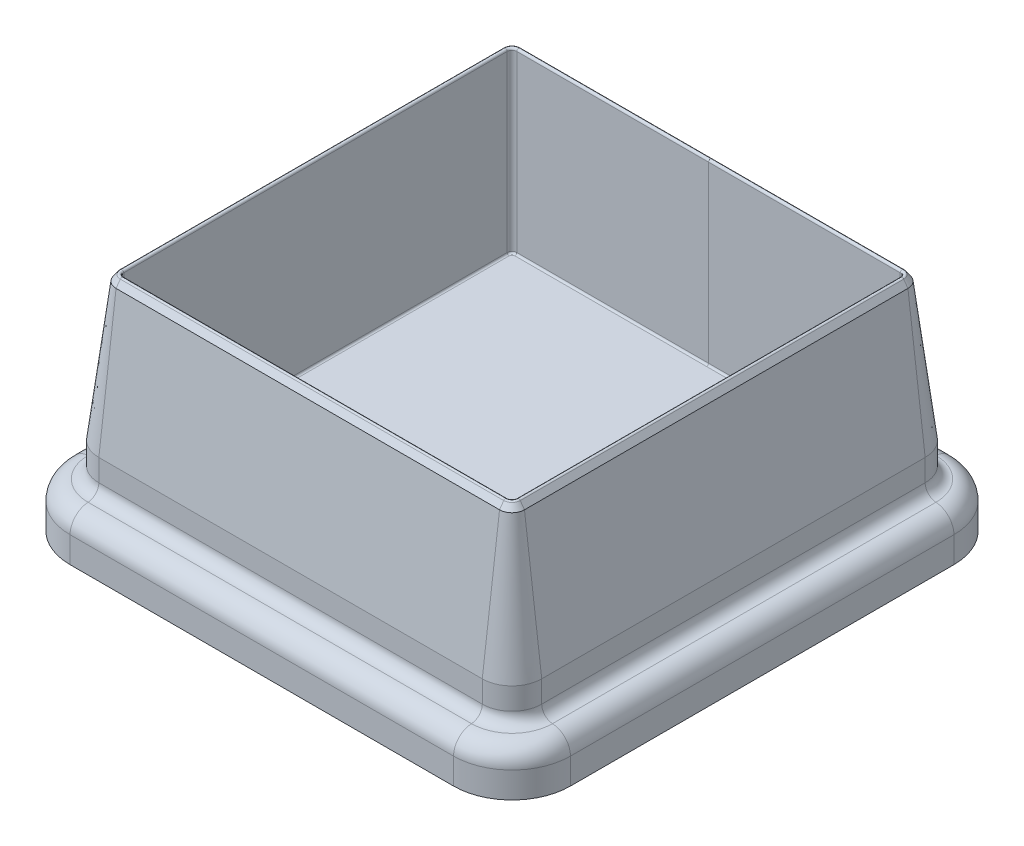
from build123d import *

# Parameters (mm, degrees)
BOSS_EXTRUDE1_DEPTH = 5.969
CUT_EXTRUDE1_DEPTH  = 0.635
BOSS_EXTRUDE2_DEPTH = 5.969
FILLET4_R           = 1.524
FILLET5_R           = 2.54
FILLET3_R           = 0.254


with BuildPart() as part:
    # Sweep1: sweep along a path in Sketch1
    with BuildLine(Plane(origin=(0, 0, 0), x_dir=(1, 0, 0), z_dir=(0, 1, 0))) as sweep1_path:
        Line((-25.4, 28.575), (25.4, 28.575))
        ThreePointArc((25.4, 28.575), (27.64506403, 27.64506403), (28.575, 25.4))
        Line((28.575, 25.4), (28.575, -25.4))
        ThreePointArc((28.575, -25.4), (27.64506403, -27.64506403), (25.4, -28.575))
        Line((25.4, -28.575), (-25.4, -28.575))
        ThreePointArc((-25.4, -28.575), (-27.64506403, -27.64506403), (-28.575, -25.4))
        Line((-28.575, -25.4), (-28.575, 25.4))
        ThreePointArc((-28.575, 25.4), (-27.64506403, 27.64506403), (-25.4, 28.575))
    # Sketch2 → Sweep1 (sweep)
    with BuildSketch(Plane(origin=(0, 0, 0), x_dir=(0, 0, -1), z_dir=(1, 0, 0))):
        Polygon((27.051, 22.68081304), (29.337, 4.432166315), (29.337, 0), (26.035, 0), (26.035, 24.13), align=None)
    sweep(path=sweep1_path.line)

    # Sketch3 → Boss-Extrude1 (add)
    with BuildSketch(Plane.XZ):
        with BuildLine():
            Line((-25.4, -29.337), (0, -29.337))
            Line((0, -29.337), (25.4, -29.337))
            ThreePointArc((25.4, -29.337), (28.183879398, -28.183879398), (29.337, -25.4))
            Line((29.337, -25.4), (29.337, 25.4))
            ThreePointArc((29.337, 25.4), (28.183879398, 28.183879398), (25.4, 29.337))
            Line((25.4, 29.337), (-25.4, 29.337))
            ThreePointArc((-25.4, 29.337), (-28.183879398, 28.183879398), (-29.337, 25.4))
            Line((-29.337, 25.4), (-29.337, -25.4))
            ThreePointArc((-29.337, -25.4), (-28.183879398, -28.183879398), (-25.4, -29.337))
        make_face()
    extrude(amount=BOSS_EXTRUDE1_DEPTH)

    # Sketch4 → Cut-Extrude1 (cut)
    with BuildSketch(Plane.XZ.offset(5.969)):
        with BuildLine():
            Line((-25.4, -27.432), (25.4, -27.432))
            ThreePointArc((25.4, -27.432), (26.836840979, -26.836840979), (27.432, -25.4))
            Line((27.432, -25.4), (27.432, 25.4))
            ThreePointArc((27.432, 25.4), (26.836840979, 26.836840979), (25.4, 27.432))
            Line((25.4, 27.432), (-25.4, 27.432))
            ThreePointArc((-25.4, 27.432), (-26.836840979, 26.836840979), (-27.432, 25.4))
            Line((-27.432, 25.4), (-27.432, -25.4))
            ThreePointArc((-27.432, -25.4), (-26.836840979, -26.836840979), (-25.4, -27.432))
        make_face()
    extrude(amount=-CUT_EXTRUDE1_DEPTH, mode=Mode.SUBTRACT)

    # Sketch5 → Boss-Extrude2 (add)
    with BuildSketch(Plane.XZ.offset(5.969)):
        with BuildLine():
            Line((-33.147, 25.4), (-33.147, -25.4))
            ThreePointArc((-33.147, -25.4), (-30.877956234, -30.877956234), (-25.4, -33.147))
            Line((-25.4, -33.147), (25.4, -33.147))
            ThreePointArc((25.4, -33.147), (30.877956234, -30.877956234), (33.147, -25.4))
            Line((33.147, -25.4), (33.147, 25.4))
            ThreePointArc((33.147, 25.4), (30.877956234, 30.877956234), (25.4, 33.147))
            Line((25.4, 33.147), (-25.4, 33.147))
            ThreePointArc((-25.4, 33.147), (-30.877956234, 30.877956234), (-33.147, 25.4))
        make_face()
        with BuildLine():
            Line((-27.432, 25.4), (-27.432, -25.4))
            ThreePointArc((-27.432, -25.4), (-26.836840979, -26.836840979), (-25.4, -27.432))
            Line((-25.4, -27.432), (25.4, -27.432))
            ThreePointArc((25.4, -27.432), (26.836840979, -26.836840979), (27.432, -25.4))
            Line((27.432, -25.4), (27.432, 25.4))
            ThreePointArc((27.432, 25.4), (26.836840979, 26.836840979), (25.4, 27.432))
            Line((25.4, 27.432), (-25.4, 27.432))
            ThreePointArc((-25.4, 27.432), (-26.836840979, 26.836840979), (-27.432, 25.4))
        make_face(mode=Mode.SUBTRACT)
    extrude(amount=-BOSS_EXTRUDE2_DEPTH)

    # Fillet4
    fillet4_edges = [part.edges().sort_by_distance(p)[0] for p in [
        (0, 0, -29.337),
        (0, 0, -29.337),
        (-28.183879398, 0, -28.183879398),
        (-29.337, 0, 0),
        (-28.183879398, 0, 28.183879398),
        (0, 0, 29.337),
        (28.183879398, 0, 28.183879398),
        (29.337, 0, 0),
        (28.183879398, 0, -28.183879398),
    ]]
    fillet(fillet4_edges, radius=FILLET4_R)

    # Fillet5
    # the kernel refuses this fillet: 2.54 mm, written as the material it takes off along each edge
    with BuildSketch(Plane(origin=(-25.4, 0, -25.4), x_dir=(-1, 0, 0), z_dir=(0, 0, 1))) as fillet5_piece_1:
        with BuildLine():
            CenterArc((5.207, 2.532054733), FILLET5_R, 273.583321698, 86.416678302)
            Line((7.747, 2.532054733), (8.001, 2.532054733))
            Line((8.001, 2.532054733), (8.001, 0))
            Line((8.001, 0), (7.747, -0.254))
            ThreePointArc((7.747, -0.254), (5.461, -0.254), (5.381625, -0.256482896))
            Line((5.381625, -0.256482896), (5.36575, -0.002979475))
        make_face()
    revolve(axis=Axis((-25.4, 0, -25.4), (0, -1, 0)), revolution_arc=90, mode=Mode.SUBTRACT)
    with BuildSketch(Plane(origin=(-33.147, 0, 25.4), x_dir=(0.9999992172213047, 0.001251222113716365, 0), z_dir=(0, 0, -1)), Plane(origin=(25.4, 0, 33.147), x_dir=(0, 0.0012512221137164234, -0.9999992172213047), z_dir=(-1, 0, 0)), Plane(origin=(33.147, 0, -25.4), x_dir=(-0.9999992172213047, 0.0012512221137164405, 0), z_dir=(0, 0, 1)), Plane(origin=(-25.4, 0, -33.147), x_dir=(0, 0.001251222113716569, 0.9999992172213047), z_dir=(1, 0, 0))) as fillet5_piece_2:
        with BuildLine():
            CenterArc((2.536829849, 2.535230855), FILLET5_R, 180.071689765, 86.416678302)
            Line((-0.003168163, 2.532052751), (-0.257167964, 2.531734941))
            Line((-0.257167964, 2.531734941), (-0.253999801, -0.00031781))
            Line((-0.253999801, -0.00031781), (0.00031781, -0.253999801))
            ThreePointArc((0.00031781, -0.253999801), (2.286316021, -0.251139507), (2.365694066, -0.253523086))
            Line((2.365694066, -0.253523086), (2.381251864, 0))
        make_face()
    extrude(amount=50.8, mode=Mode.SUBTRACT)
    with BuildSketch(Plane(origin=(-25.4, 0, 25.4), x_dir=(0, 0, 1), z_dir=(1, 0, 0))) as fillet5_piece_3:
        with BuildLine():
            CenterArc((5.207, 2.532054733), FILLET5_R, 273.583321698, 86.416678302)
            Line((7.747, 2.532054733), (8.001, 2.532054733))
            Line((8.001, 2.532054733), (8.001, 0))
            Line((8.001, 0), (7.747, -0.254))
            ThreePointArc((7.747, -0.254), (5.461, -0.254), (5.381625, -0.256482896))
            Line((5.381625, -0.256482896), (5.36575, -0.002979475))
        make_face()
    revolve(axis=Axis((-25.4, 0, 25.4), (0, -1, 0)), revolution_arc=90, mode=Mode.SUBTRACT)
    with BuildSketch(Plane(origin=(25.4, 0, 25.4), x_dir=(1, 0, 0), z_dir=(0, 0, -1))) as fillet5_piece_4:
        with BuildLine():
            CenterArc((5.207, 2.532054733), FILLET5_R, 273.583321698, 86.416678302)
            Line((7.747, 2.532054733), (8.001, 2.532054733))
            Line((8.001, 2.532054733), (8.001, 0))
            Line((8.001, 0), (7.747, -0.254))
            ThreePointArc((7.747, -0.254), (5.461, -0.254), (5.381625, -0.256482896))
            Line((5.381625, -0.256482896), (5.36575, -0.002979475))
        make_face()
    revolve(axis=Axis((25.4, 0, 25.4), (0, -1, 0)), revolution_arc=90, mode=Mode.SUBTRACT)
    with BuildSketch(Plane(origin=(25.4, 0, -25.4), x_dir=(0, 0, -1), z_dir=(-1, 0, 0))) as fillet5_piece_5:
        with BuildLine():
            CenterArc((5.207, 2.532054733), FILLET5_R, 273.583321698, 86.416678302)
            Line((7.747, 2.532054733), (8.001, 2.532054733))
            Line((8.001, 2.532054733), (8.001, 0))
            Line((8.001, 0), (7.747, -0.254))
            ThreePointArc((7.747, -0.254), (5.461, -0.254), (5.381625, -0.256482896))
            Line((5.381625, -0.256482896), (5.36575, -0.002979475))
        make_face()
    revolve(axis=Axis((25.4, 0, -25.4), (0, -1, 0)), revolution_arc=90, mode=Mode.SUBTRACT)

    # Fillet3
    fillet3_edges = [part.edges().sort_by_distance(p)[0] for p in [
        (25.849012806, 24.13, 25.849012806),
        (0, 0, 26.035),
        (0, 24.13, 26.035),
        (-25.849012806, 0, 25.849012806),
        (-25.849012806, 24.13, 25.849012806),
        (0, 0, -26.035),
        (-26.035, 0, 0),
        (-26.035, 24.13, 0),
        (-25.849012806, 0, -25.849012806),
        (-25.849012806, 24.13, -25.849012806),
        (0, 0, -26.035),
        (0, 24.13, -26.035),
        (0, 24.13, -26.035),
        (25.849012806, 0, -25.849012806),
        (25.849012806, 24.13, -25.849012806),
        (26.035, 0, 0),
        (26.035, 24.13, 0),
        (25.849012806, 0, 25.849012806),
    ]]
    fillet(fillet3_edges, radius=FILLET3_R)


solid = part.part
